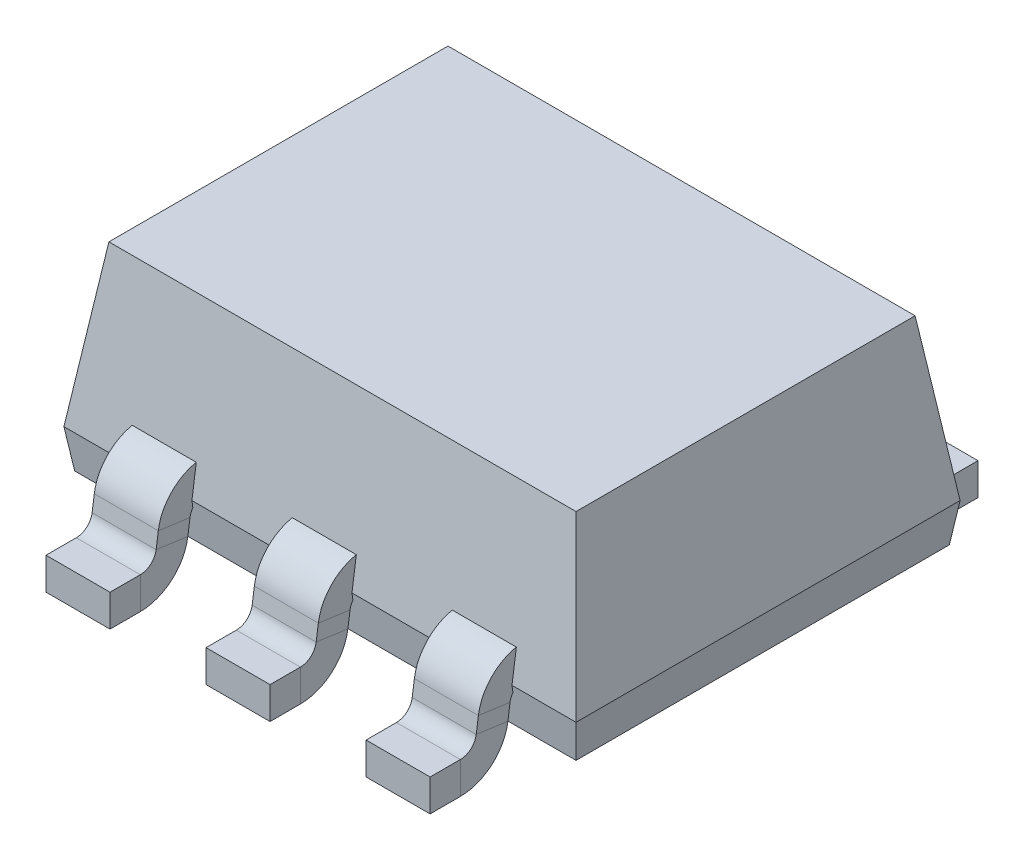
from build123d import *

# Parameters (mm, degrees)
SKETCH1_W                     = 1.6
SKETCH1_H                     = 1.2
BOSS_EXTRUDE1_DEPTH           = 0.5
BOSS_EXTRUDE1_TAPER           = 8
BOSS_EXTRUDE1_OTHER_WAY_DEPTH = 0.12
BOSS_EXTRUDE1_OTHER_WAY_TAPER = 8
BASE_FLANGE2_DEPTH            = 0.1
LPATTERN1_COUNT               = 2
LPATTERN1_PITCH               = 0.5
LPATTERN1_2_COUNT             = 2
LPATTERN1_2_PITCH             = 0.5


# Sheet-metal steps are written as plain solids
with BuildPart() as part:
    # Sketch1 → Boss-Extrude1 (new body)
    with BuildSketch(Plane(origin=(0, 0, 0), x_dir=(1, 0, 0), z_dir=(0, 1, 0))):
        Rectangle(SKETCH1_W, SKETCH1_H)
    extrude(amount=BOSS_EXTRUDE1_DEPTH, taper=BOSS_EXTRUDE1_TAPER)

    # Sketch1 → Boss-Extrude1 other way (add)
    with BuildSketch(Plane(origin=(0, 0, 0), x_dir=(1, 0, 0), z_dir=(0, 1, 0))):
        Rectangle(SKETCH1_W, SKETCH1_H)
    extrude(amount=-BOSS_EXTRUDE1_OTHER_WAY_DEPTH, taper=BOSS_EXTRUDE1_OTHER_WAY_TAPER)


with BuildPart() as body_2:
    # Sketch2 → Base-Flange2 (new, symmetric)
    with BuildSketch(Plane.ZY):
        with BuildLine():
            Line((0.4, 0), (0.556535663, 0))
            ThreePointArc((0.556535663, 0), (0.589338615, -0.012264521), (0.606049067, -0.043041345))
            Line((0.606049067, -0.043041345), (0.612771784, -0.090875965))
            ThreePointArc((0.612771784, -0.090875965), (0.66290314, -0.183206437), (0.761311994, -0.22))
            Line((0.761311994, -0.22), (0.855918984, -0.22))
            Line((0.855918984, -0.22), (0.855918984, -0.12))
            Line((0.855918984, -0.12), (0.761311994, -0.12))
            ThreePointArc((0.761311994, -0.12), (0.728509043, -0.107735479), (0.711798591, -0.076958655))
            Line((0.711798591, -0.076958655), (0.705075873, -0.029124035))
            ThreePointArc((0.705075873, -0.029124035), (0.654944517, 0.063206437), (0.556535663, 0.1))
            Line((0.556535663, 0.1), (0.4, 0.1))
            Line((0.4, 0.1), (0.4, 0))
        make_face()
    extrude(amount=BASE_FLANGE2_DEPTH, both=True)


with BuildPart() as lpattern1_1:
    # LPattern1: pattern copy
    add(body_2.part.moved(Location(Vector(1, 0, 0) * (1 * LPATTERN1_PITCH))))


with BuildPart() as lpattern1_2_1:
    # LPattern1 2: pattern copy
    add(body_2.part.moved(Location(Vector(-1, 0, 0) * (1 * LPATTERN1_2_PITCH))))


with BuildPart() as body_5:
    # Mirror1: mirrored copy
    add(lpattern1_2_1.part.mirror(Plane(origin=(0, 0, 0), x_dir=(1, 0, 0), z_dir=(0, 0, -1))))


with BuildPart() as body_6:
    # Mirror1 2: mirrored copy
    add(body_2.part.mirror(Plane(origin=(0, 0, 0), x_dir=(1, 0, 0), z_dir=(0, 0, -1))))


with BuildPart() as body_7:
    # Mirror1 3: mirrored copy
    add(lpattern1_1.part.mirror(Plane(origin=(0, 0, 0), x_dir=(1, 0, 0), z_dir=(0, 0, -1))))


solid = Compound([part.part, body_2.part, lpattern1_1.part, lpattern1_2_1.part, body_5.part, body_6.part, body_7.part])
